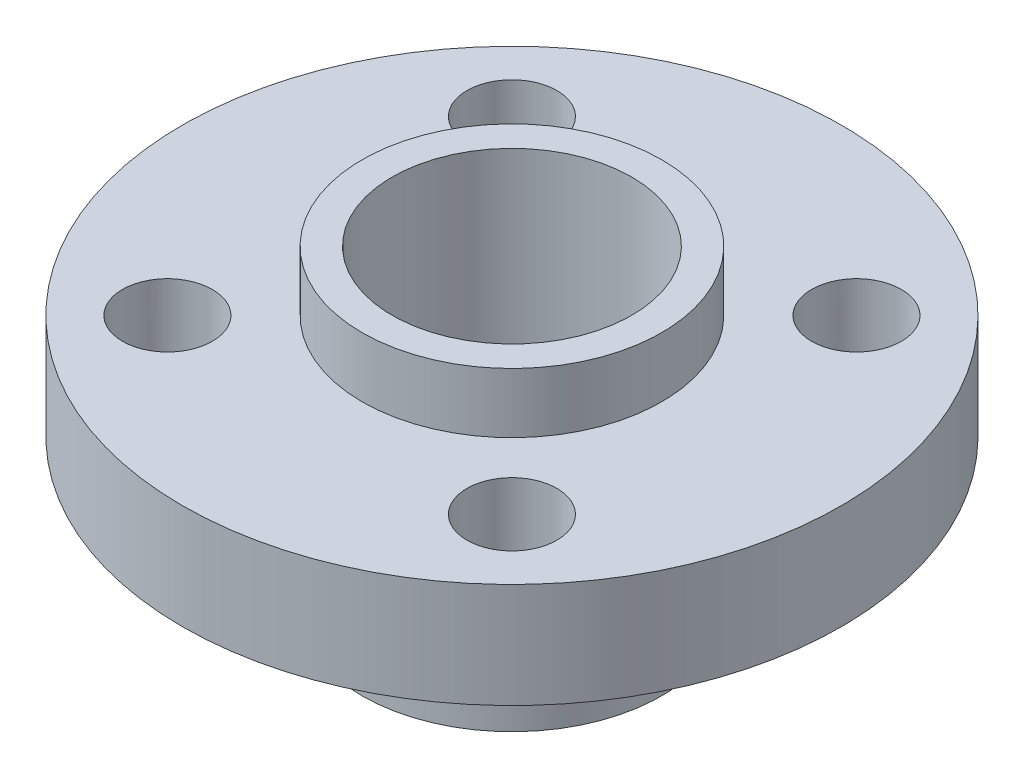
from build123d import *

# Parameters (mm, degrees)
SKETCH1_R           = 5
SKETCH1_R_2         = 4
BOSS_EXTRUDE1_DEPTH = 10.5
BOSS_EXTRUDE2_START = -2
SKETCH2_R           = 11
SKETCH2_R_2         = 4.5
BOSS_EXTRUDE2_DEPTH = 3.5
SKETCH3_R           = 1.5
CUT_EXTRUDE1_DEPTH  = 18.727097901


with BuildPart() as part:
    # Sketch1 → Boss-Extrude1 (new body)
    with BuildSketch(Plane(origin=(0, 0, 0), x_dir=(1, 0, 0), z_dir=(0, 1, 0))):
        Circle(SKETCH1_R)
        Circle(SKETCH1_R_2, mode=Mode.SUBTRACT)
    extrude(amount=BOSS_EXTRUDE1_DEPTH)

    # Sketch2 → Boss-Extrude2 (add)
    with BuildSketch(Plane(origin=(0, 10.5, 0), x_dir=(1, 0, 0), z_dir=(0, 1, 0)).offset(BOSS_EXTRUDE2_START)):
        Circle(SKETCH2_R)
        Circle(SKETCH2_R_2, mode=Mode.SUBTRACT)
    extrude(amount=-BOSS_EXTRUDE2_DEPTH)

    # Sketch3 → Cut-Extrude1 (cut, through all)
    with BuildSketch(Plane(origin=(0, 8.5, 0), x_dir=(1, 0, 0), z_dir=(0, 1, 0))):
        with Locations((-5.75, 5.75)):
            Circle(SKETCH3_R)
        with Locations((5.75, 5.75)):
            Circle(SKETCH3_R)
        with Locations((5.75, -5.75)):
            Circle(SKETCH3_R)
        with Locations((-5.75, -5.75)):
            Circle(SKETCH3_R)
    extrude(amount=-CUT_EXTRUDE1_DEPTH, mode=Mode.SUBTRACT)


solid = part.part
